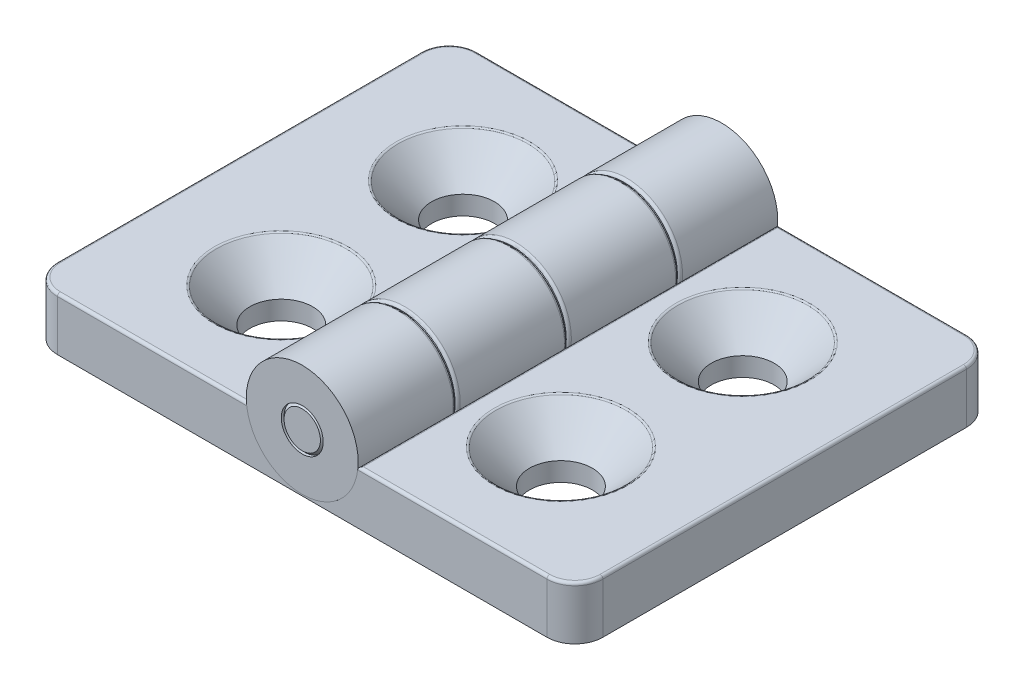
from build123d import *

# Parameters (mm, degrees)
SKETCH_1_R                  = 4
SKETCH_1_R_2                = 1.5
EXTRUDE_1_DEPTH             = 15
SKETCH_2_R                  = 1.5
EXTRUDE_2_DEPTH             = 15
CHAMFER_1_SIZE              = 0.2
SKETCH_3_W                  = 1.062209714
SKETCH_3_H                  = 0.1
FILLET_1_R                  = 0.2
EXTRUDE_6_DEPTH             = 30
HOLE_WIZARD_M4_1_AT_2_COUNT = 2
HOLE_WIZARD_M4_1_AT_2_PITCH = 20
HOLE_WIZARD_M4_1_AT_3_COUNT = 2
HOLE_WIZARD_M4_1_AT_3_PITCH = 13
HOLE_WIZARD_M4_1_AT_4_COUNT = 2
HOLE_WIZARD_M4_1_AT_4_PITCH = 23.853720884
FILLET_2_R                  = 0.2
FILLET_3_R                  = 2
CHAMFER_2_SIZE              = 0.5


with BuildPart() as part:
    # 草图1 → 凸台-拉伸1 (new, symmetric)
    with BuildSketch(Plane.XY):
        Circle(SKETCH_1_R)
        Circle(SKETCH_1_R_2, mode=Mode.SUBTRACT)
    extrude(amount=EXTRUDE_1_DEPTH, both=True)

    # 草图3 → 切除-旋转1 (revolve, cut)
    with BuildSketch(Plane(origin=(0, 0, 0), x_dir=(1, 0, 0), z_dir=(0, 1, 0))):
        with Locations((4.363574537, 7.95)):
            Rectangle(SKETCH_3_W, SKETCH_3_H)
        with Locations((4.363574537, 0)):
            Rectangle(SKETCH_3_W, SKETCH_3_H)
        with Locations((4.363574537, -7.95)):
            Rectangle(SKETCH_3_W, SKETCH_3_H)
    revolve(axis=Axis((0, 0, 15), (0, 0, -1)), mode=Mode.SUBTRACT)

    # 圆角1
    # the kernel refuses this fillet: 0.2 mm, written as the material it takes off along each edge
    with BuildSketch(Plane(origin=(0, 0, -7.9), x_dir=(1, 0, 0), z_dir=(0, -1, 0))) as fillet_1_piece_1:
        with BuildLine():
            CenterArc((3.8, 0.1973467), FILLET_1_R, 279.343232253, 80.656767747)
            Line((4, 0.1973467), (4.004, 0.1973467))
            Line((4.004, 0.1973467), (4.004, 0))
            Line((4.004, 0), (4, -0.004))
            ThreePointArc((4, -0.004), (3.91623484, -0.004), (3.833119074, -0.003946934))
            Line((3.833119074, -0.003946934), (3.83246968, 0))
        make_face()
    revolve(axis=Axis((0, 0, -7.9), (0, 0, 1)), mode=Mode.SUBTRACT)
    with BuildSketch(Plane(origin=(0, 0, -8), x_dir=(1, 0, 0), z_dir=(0, -1, 0))) as fillet_1_piece_2:
        with BuildLine():
            CenterArc((3.8, -0.1973467), FILLET_1_R, 0, 80.656767747)
            Line((3.83246968, 0), (3.833119074, 0.003946934))
            ThreePointArc((3.833119074, 0.003946934), (3.91623484, 0.004), (4, 0.004))
            Line((4, 0.004), (4.004, 0))
            Line((4.004, 0), (4.004, -0.1973467))
            Line((4.004, -0.1973467), (4, -0.1973467))
        make_face()
    revolve(axis=Axis((0, 0, -8), (0, 0, 1)), mode=Mode.SUBTRACT)
    with BuildSketch(Plane(origin=(0, 0, 0.05), x_dir=(1, 0, 0), z_dir=(0, -1, 0))) as fillet_1_piece_3:
        with BuildLine():
            CenterArc((3.8, 0.1973467), FILLET_1_R, 279.343232253, 80.656767747)
            Line((4, 0.1973467), (4.004, 0.1973467))
            Line((4.004, 0.1973467), (4.004, 0))
            Line((4.004, 0), (4, -0.004))
            ThreePointArc((4, -0.004), (3.91623484, -0.004), (3.833119074, -0.003946934))
            Line((3.833119074, -0.003946934), (3.83246968, 0))
        make_face()
    revolve(axis=Axis((0, 0, 0.05), (0, 0, 1)), mode=Mode.SUBTRACT)
    with BuildSketch(Plane(origin=(0, 0, -0.05), x_dir=(1, 0, 0), z_dir=(0, -1, 0))) as fillet_1_piece_4:
        with BuildLine():
            CenterArc((3.8, -0.1973467), FILLET_1_R, 0, 80.656767747)
            Line((3.83246968, 0), (3.833119074, 0.003946934))
            ThreePointArc((3.833119074, 0.003946934), (3.91623484, 0.004), (4, 0.004))
            Line((4, 0.004), (4.004, 0))
            Line((4.004, 0), (4.004, -0.1973467))
            Line((4.004, -0.1973467), (4, -0.1973467))
        make_face()
    revolve(axis=Axis((0, 0, -0.05), (0, 0, 1)), mode=Mode.SUBTRACT)
    with BuildSketch(Plane(origin=(0, 0, 8), x_dir=(1, 0, 0), z_dir=(0, -1, 0))) as fillet_1_piece_5:
        with BuildLine():
            CenterArc((3.8, 0.1973467), FILLET_1_R, 279.343232253, 80.656767747)
            Line((3.83246968, 0), (3.833119074, -0.003946934))
            ThreePointArc((3.833119074, -0.003946934), (3.91623484, -0.004), (4, -0.004))
            Line((4, -0.004), (4.004, 0))
            Line((4.004, 0), (4.004, 0.1973467))
            Line((4.004, 0.1973467), (4, 0.1973467))
        make_face()
    revolve(axis=Axis((0, 0, 8), (0, 0, 1)), mode=Mode.SUBTRACT)
    with BuildSketch(Plane(origin=(0, 0, 7.9), x_dir=(1, 0, 0), z_dir=(0, -1, 0))) as fillet_1_piece_6:
        with BuildLine():
            CenterArc((3.8, -0.1973467), FILLET_1_R, 0, 80.656767747)
            Line((4, -0.1973467), (4.004, -0.1973467))
            Line((4.004, -0.1973467), (4.004, 0))
            Line((4.004, 0), (4, 0.004))
            ThreePointArc((4, 0.004), (3.91623484, 0.004), (3.833119074, 0.003946934))
            Line((3.833119074, 0.003946934), (3.83246968, 0))
        make_face()
    revolve(axis=Axis((0, 0, 7.9), (0, 0, 1)), mode=Mode.SUBTRACT)


with BuildPart() as body_2:
    # 草图2 → 凸台-拉伸2 (new, symmetric)
    with BuildSketch(Plane.XY):
        Circle(SKETCH_2_R)
    extrude(amount=EXTRUDE_2_DEPTH, both=True)

    # 倒角1
    chamfer_1_edges = [body_2.edges().sort_by_distance(p)[0] for p in [
        (-1.5, 0, 15),
    ]]
    chamfer(chamfer_1_edges, length=CHAMFER_1_SIZE)

    # 倒角2
    chamfer_2_edges = [body_2.edges().sort_by_distance(p)[0] for p in [
        (-1.5, 0, -15),
    ]]
    chamfer(chamfer_2_edges, length=CHAMFER_2_SIZE)


with BuildPart() as body_3:
    # 草图5 → 凸台-拉伸6 (new body)
    with BuildSketch(Plane(origin=(0, 0, -15), x_dir=(-1, 0, 0), z_dir=(0, 0, -1))):
        with BuildLine():
            Line((3.988734135, -0.3), (19.5, -0.3))
            Line((19.5, -0.3), (19.5, -4.1))
            Line((19.5, -4.1), (-19.5, -4.1))
            Line((-19.5, -4.1), (-19.5, -0.3))
            Line((-19.5, -0.3), (-3.988734135, -0.3))
            ThreePointArc((-3.988734135, -0.3), (0, -4), (3.988734135, -0.3))
        make_face()
    extrude(amount=-EXTRUDE_6_DEPTH)

    # 草图6 → M4 平头机械螺钉的锥形沉头孔1 (revolve, cut)
    with BuildSketch(Plane(origin=(-10, -0.3, -6.5), x_dir=(0, 0, 1), z_dir=(1, 0, 0))):
        Polygon((0, 0), (0, 3.8), (2.25, 3.8), (2.25, 2.45), (4.7, 0), align=None)
    hole_wizard_m4_1 = revolve(axis=Axis((-10, 6.05, -6.5), (0, -1, 0)), mode=Mode.SUBTRACT)

    # M4 平头机械螺钉的锥形沉头孔1 at 2: M4 平头机械螺钉的锥形沉头孔1 ×2
    with Locations(*[(i * HOLE_WIZARD_M4_1_AT_2_PITCH, 0, 0) for i in range(1, HOLE_WIZARD_M4_1_AT_2_COUNT)]):
        add(hole_wizard_m4_1, mode=Mode.SUBTRACT)

    # M4 平头机械螺钉的锥形沉头孔1 at 3: M4 平头机械螺钉的锥形沉头孔1 ×2
    with Locations(*[(0, 0, i * HOLE_WIZARD_M4_1_AT_3_PITCH) for i in range(1, HOLE_WIZARD_M4_1_AT_3_COUNT)]):
        add(hole_wizard_m4_1, mode=Mode.SUBTRACT)

    # M4 平头机械螺钉的锥形沉头孔1 at 4: M4 平头机械螺钉的锥形沉头孔1 ×2
    with Locations(*[Vector(0.8384436163006371, 0, 0.5449883505954142) * (i * HOLE_WIZARD_M4_1_AT_4_PITCH) for i in range(1, HOLE_WIZARD_M4_1_AT_4_COUNT)]):
        add(hole_wizard_m4_1, mode=Mode.SUBTRACT)

    # 圆角2
    fillet_2_edges = [body_3.edges().sort_by_distance(p)[0] for p in [
        (-11.744367068, -0.3, -15),
        (10, -0.3, 1.8),
        (11.744367068, -0.3, -15),
        (-10, -0.3, 1.8),
        (-19.5, -0.3, 0),
        (-11.744367068, -0.3, 15),
        (10, -0.3, -11.2),
        (-3.988734135, -0.3, 0),
        (3.988734135, -0.3, 0),
        (11.744367068, -0.3, 15),
        (19.5, -0.3, 0),
        (-10, -0.3, -11.2),
    ]]
    fillet(fillet_2_edges, radius=FILLET_2_R)

    # 圆角3
    # the kernel refuses this fillet: 2 mm, written as the material it takes off along each edge
    with BuildSketch(Plane(origin=(17.5, -0.3, 13), x_dir=(0, 0, 1), z_dir=(-1, 0, 0))) as fillet_3_piece_1:
        with BuildLine():
            CenterArc((1.8, -0.2), 0.2, 0, 90)
            Line((2, -0.2), (2, 0))
            Line((2, 0), (1.8, 0))
        make_face()
    revolve(axis=Axis((17.5, -0.3, 13), (0, 1, 0)), revolution_arc=90, mode=Mode.SUBTRACT)
    with BuildSketch(Plane(origin=(17.5, -0.3, -13), x_dir=(1, 0, 0), z_dir=(0, 0, 1))) as fillet_3_piece_2:
        with BuildLine():
            CenterArc((1.8, -0.2), 0.2, 0, 90)
            Line((2, -0.2), (2, 0))
            Line((2, 0), (1.8, 0))
        make_face()
    revolve(axis=Axis((17.5, -0.3, -13), (0, 1, 0)), revolution_arc=90, mode=Mode.SUBTRACT)
    with BuildSketch(Plane(origin=(-17.5, -0.3, 13), x_dir=(-1, 0, 0), z_dir=(0, 0, -1))) as fillet_3_piece_3:
        with BuildLine():
            CenterArc((1.8, -0.2), 0.2, 0, 90)
            Line((2, -0.2), (2, 0))
            Line((2, 0), (1.8, 0))
        make_face()
    revolve(axis=Axis((-17.5, -0.3, 13), (0, 1, 0)), revolution_arc=90, mode=Mode.SUBTRACT)
    with BuildSketch(Plane(origin=(-17.5, -0.3, -13), x_dir=(0, 0, -1), z_dir=(1, 0, 0))) as fillet_3_piece_4:
        with BuildLine():
            CenterArc((1.8, -0.2), 0.2, 0, 90)
            Line((2, -0.2), (2, 0))
            Line((2, 0), (1.8, 0))
        make_face()
    revolve(axis=Axis((-17.5, -0.3, -13), (0, 1, 0)), revolution_arc=90, mode=Mode.SUBTRACT)
    with BuildSketch(Plane(origin=(-19.5, -0.3, -15), x_dir=(1, 0, 0), z_dir=(0, -1, 0)), Plane(origin=(-19.5, -0.3, 15), x_dir=(0, 0, -1), z_dir=(0, -1, 0)), Plane(origin=(19.5, -9.1, -15), x_dir=(-1, 0, 0), z_dir=(0, 1, 0))) as fillet_3_piece_5:
        with BuildLine():
            CenterArc((FILLET_3_R, FILLET_3_R), FILLET_3_R, 180, 90)
            Line((0, FILLET_3_R), (0, 0))
            Line((0, 0), (FILLET_3_R, 0))
        make_face()
    extrude(amount=8.8, mode=Mode.SUBTRACT)
    with BuildSketch(Plane(origin=(19.5, -9.1, 15), x_dir=(-1, 0, 0), z_dir=(0, 1, 0))) as fillet_3_piece_6:
        with BuildLine():
            CenterArc((FILLET_3_R, -FILLET_3_R), FILLET_3_R, 90, 90)
            Line((0, -FILLET_3_R), (0, 0))
            Line((0, 0), (FILLET_3_R, 0))
        make_face()
    extrude(amount=8.8, mode=Mode.SUBTRACT)


solid = Compound([part.part, body_2.part, body_3.part])
